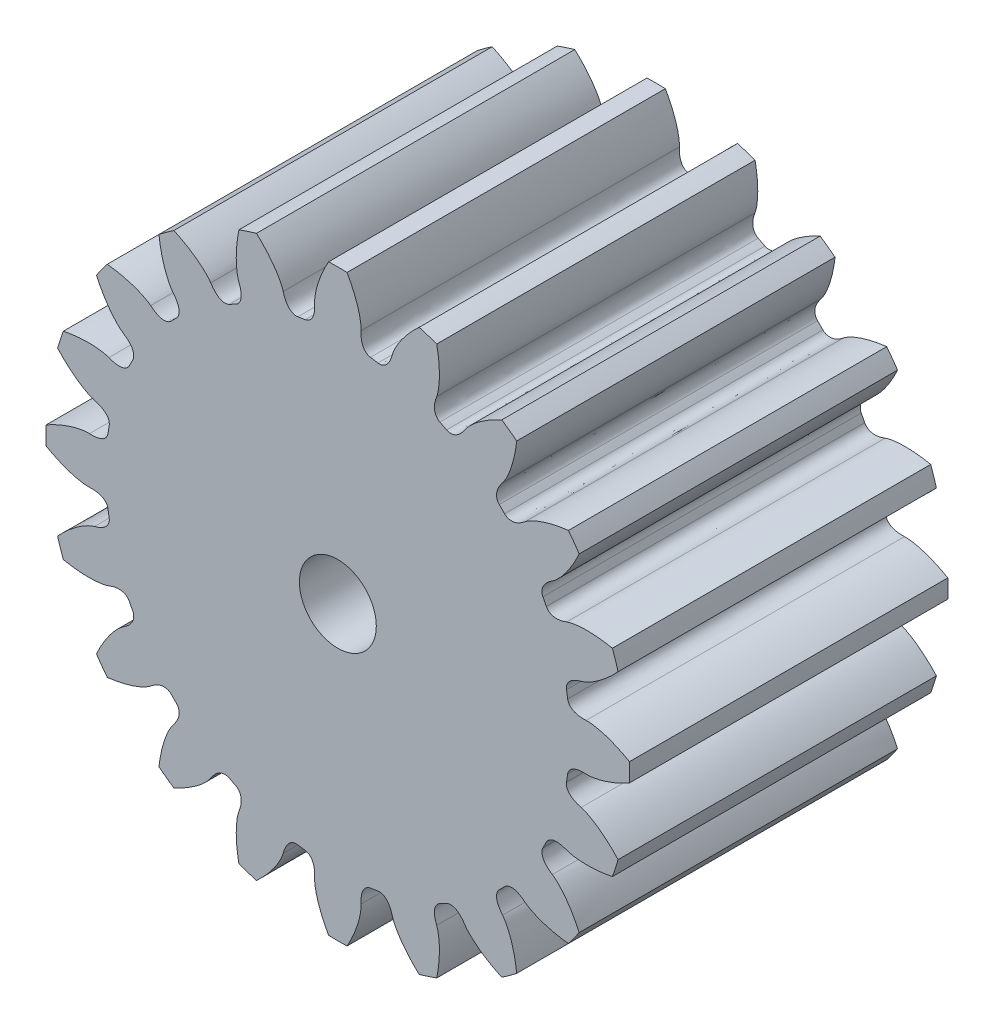
from build123d import *

# Parameters (mm, degrees)
SKETCH_1_R               = 8.75
EXTRUDE_1_DEPTH          = 12
EXTRUDE_START            = -12
EXTRUDE_3_DEPTH          = 12
PATTERN_CIRCULAR_1_COUNT = 20
SKETCH_3_R               = 1.45
CUT_EXTRUDE_1_DEPTH      = 50


# Read off the part's stored shape, not the designer's step: 보스-돌출3
with BuildPart() as part:
    # 스케치1 → 보스-돌출1 (new body)
    with BuildSketch(Plane.XY):
        Circle(SKETCH_1_R)
    extrude(amount=EXTRUDE_1_DEPTH)

    # 보스-돌출3 outline → 보스-돌출3 (add)
    with BuildSketch(Plane(origin=(0, 0, 0), x_dir=(-1, 0, 0), z_dir=(0, 0, -1)).offset(EXTRUDE_START)):
        with BuildLine():
            add(Edge.make_bspline(
                [(0.877055856, 9.359151175), (0.872179635, 9.285462301), (0.872049243, 9.177409008), (0.893327315, 9.03883085), (0.920017189, 8.943680783), (0.961409814, 8.852821598), (1.047583537, 8.734522692), (1.150113467, 8.675233933), (1.228449614, 8.663337206)],
                knots=[0, 0, 0, 0, 0.257550973, 0.374687481, 0.487633979, 0.600912128, 0.720919164, 0.993174308, 0.993174308, 0.993174308, 0.993174308], degree=3))
            add(Edge.make_bspline(
                [(0.877055856, 9.359151175), (0.879376071, 9.404260902), (0.875507166, 9.496939144), (0.856749496, 9.652552359), (0.819970312, 9.841323069), (0.756810218, 10.075054124), (0.617418965, 10.473872979), (0.467524211, 10.781941248), (0.347382117, 10.994513435)],
                knots=[0, 0, 0, 0, 0.077991928, 0.159989772, 0.270655666, 0.409989628, 0.577991667, 1, 1, 1, 1], degree=3))
            ThreePointArc((0.347382117, 10.994513435), (0, 11), (-0.347382117, 10.994513435))
            add(Edge.make_bspline(
                [(-0.877055856, 9.359151175), (-0.879376071, 9.404260902), (-0.875507166, 9.496939144), (-0.856749496, 9.652552359), (-0.819970312, 9.841323069), (-0.756810218, 10.075054124), (-0.617418965, 10.473872979), (-0.467524211, 10.781941248), (-0.347382117, 10.994513435)],
                knots=[0, 0, 0, 0, 0.077991928, 0.159989772, 0.270655666, 0.409989628, 0.577991667, 1, 1, 1, 1], degree=3))
            add(Edge.make_bspline(
                [(-0.877055856, 9.359151175), (-0.872179635, 9.285462301), (-0.872049243, 9.177409008), (-0.893327315, 9.03883085), (-0.920017189, 8.943680783), (-0.961409814, 8.852821598), (-1.047583537, 8.734522692), (-1.150113467, 8.675233933), (-1.228449614, 8.663337206)],
                knots=[0, 0, 0, 0, 0.257550973, 0.374687481, 0.487633979, 0.600912128, 0.720919164, 0.993174309, 0.993174309, 0.993174309, 0.993174309], degree=3))
            ThreePointArc((-1.228449614, 8.663337206), (0, 8.75), (1.228449614, 8.663337206))
        make_face()
    extrude_3 = extrude(amount=EXTRUDE_3_DEPTH)

    # 원형 패턴1: 보스-돌출3 ×20 about axis
    pattern_circular_1_axis = Axis((0, 0, 12), (0, 0, -1))
    for i in range(1, PATTERN_CIRCULAR_1_COUNT):
        add(extrude_3.rotate(pattern_circular_1_axis, i * 360 / PATTERN_CIRCULAR_1_COUNT))

    # 스케치3 → 컷-돌출1 (cut)
    with BuildSketch(Plane.XY.offset(12)):
        Circle(SKETCH_3_R)
    extrude(amount=-CUT_EXTRUDE_1_DEPTH, mode=Mode.SUBTRACT)


solid = part.part
